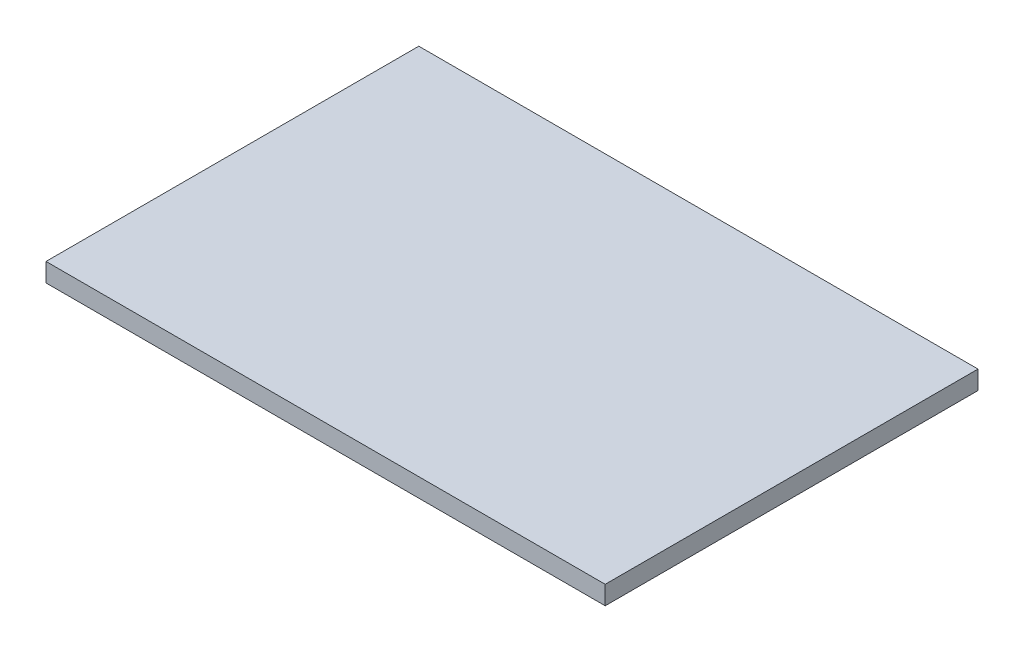
from build123d import *

# Parameters (mm, degrees)
SKIZZE1_W                       = 60
SKIZZE1_H                       = 40
AUFSATZ_LINEAR_AUSTRAGEN1_DEPTH = 2


with BuildPart() as part:
    # Skizze1 → Aufsatz-Linear austragen1 (new body)
    with BuildSketch(Plane(origin=(0, 0, 0), x_dir=(1, 0, 0), z_dir=(0, 1, 0))):
        with Locations((30, 20)):
            Rectangle(SKIZZE1_W, SKIZZE1_H)
    extrude(amount=AUFSATZ_LINEAR_AUSTRAGEN1_DEPTH)


solid = part.part
